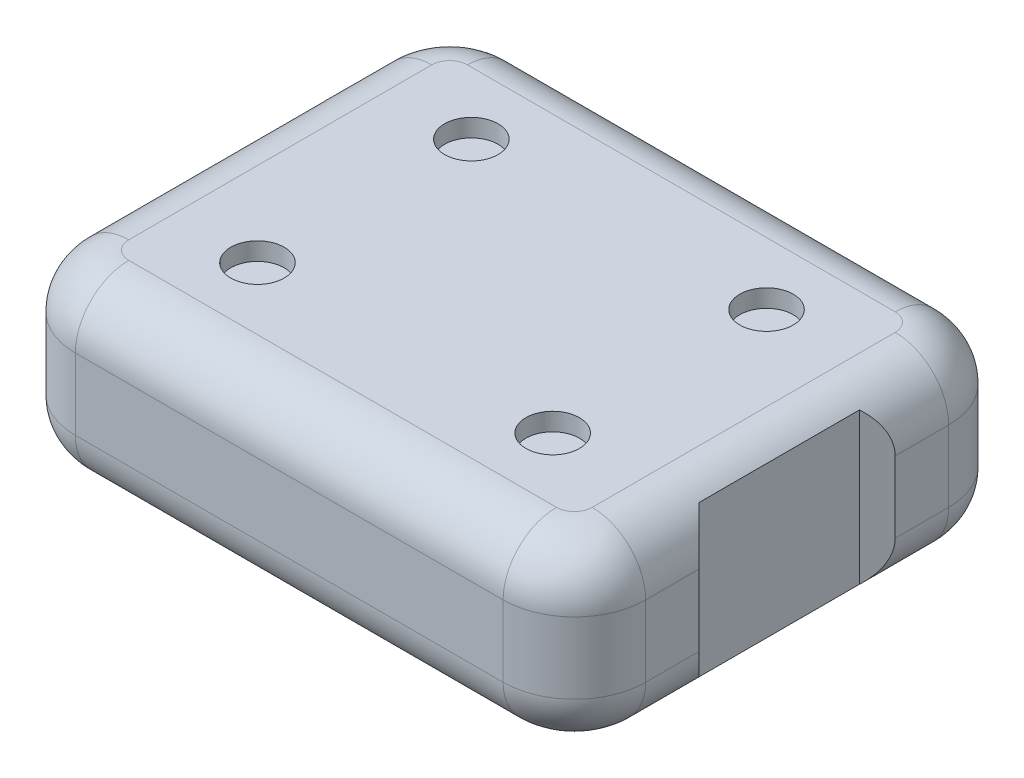
from build123d import *

# Parameters (mm, degrees)
BOSS_EXTRUDE1_DEPTH = 1
FILLET2_R           = 0.3
SKETCH2_R           = 0.15
CUT_EXTRUDE1_DEPTH  = 0.1


with BuildPart() as part:
    # Sketch1 → Boss-Extrude1 (new body)
    with BuildSketch(Plane(origin=(0, 0, 0), x_dir=(1, 0, 0), z_dir=(0, 1, 0))):
        with BuildLine():
            Line((-1.2, -1.25), (1.2, -1.25))
            ThreePointArc((1.2, -1.25), (1.482842712, -1.132842712), (1.6, -0.85))
            Line((1.6, -0.85), (1.6, -0.55))
            Line((1.6, -0.55), (1.5, -0.45))
            Line((1.5, -0.45), (1.5, 0.45))
            Line((1.5, 0.45), (1.6, 0.55))
            Line((1.6, 0.55), (1.6, 0.85))
            ThreePointArc((1.6, 0.85), (1.482842712, 1.132842712), (1.2, 1.25))
            Line((1.2, 1.25), (-1.2, 1.25))
            ThreePointArc((-1.2, 1.25), (-1.482842712, 1.132842712), (-1.6, 0.85))
            Line((-1.6, 0.85), (-1.6, 0.55))
            Line((-1.6, 0.55), (-1.5, 0.45))
            Line((-1.5, 0.45), (-1.5, -0.45))
            Line((-1.5, -0.45), (-1.6, -0.55))
            Line((-1.6, -0.55), (-1.6, -0.85))
            ThreePointArc((-1.6, -0.85), (-1.482842712, -1.132842712), (-1.2, -1.25))
        make_face()
    extrude(amount=BOSS_EXTRUDE1_DEPTH)

    # Fillet2
    # the kernel refuses this fillet: 0.3 mm, written as the material it takes off along each edge
    with BuildSketch(Plane(origin=(-1.2, 1, 0.85), x_dir=(-1, 0, 0), z_dir=(0, 0, -1))) as fillet2_piece_1:
        with BuildLine():
            CenterArc((0.4 - FILLET2_R, -FILLET2_R), FILLET2_R, 0, 90)
            Line((0.4 - FILLET2_R, 0), (0.4, 0))
            Line((0.4, 0), (0.4, -FILLET2_R))
        make_face()
    revolve(axis=Axis((-1.2, 1, 0.85), (0, 1, 0)), revolution_arc=90, mode=Mode.SUBTRACT)
    with BuildSketch(Plane(origin=(-1.2, 1, 1.25), x_dir=(0, -1, 0), z_dir=(1, 0, 0)), Plane(origin=(1.2, 1, -1.25), x_dir=(0, -1, 0), z_dir=(-1, 0, 0))) as fillet2_piece_2:
        with BuildLine():
            CenterArc((FILLET2_R, FILLET2_R), FILLET2_R, 180, 90)
            Line((0, FILLET2_R), (0, 0))
            Line((0, 0), (FILLET2_R, 0))
        make_face()
    extrude(amount=2.4, mode=Mode.SUBTRACT)
    with BuildSketch(Plane(origin=(-1.6, 1, -0.85), x_dir=(0, -1, 0), z_dir=(0, 0, 1)), Plane(origin=(1.6, 1, 0.2), x_dir=(0, -1, 0), z_dir=(0, 0, -1)), Plane(origin=(1.6, 1, 0.85), x_dir=(0, -1, 0), z_dir=(0, 0, -1)), Plane(origin=(-1.6, 1, -0.2), x_dir=(0, -1, 0), z_dir=(0, 0, 1))) as fillet2_piece_3:
        with BuildLine():
            CenterArc((FILLET2_R, FILLET2_R), FILLET2_R, 180, 90)
            Line((0, FILLET2_R), (0, 0))
            Line((0, 0), (FILLET2_R, 0))
        make_face()
    extrude(amount=1.05, mode=Mode.SUBTRACT)
    with BuildSketch(Plane(origin=(-1.2, 1, -0.85), x_dir=(0, 0, -1), z_dir=(1, 0, 0))) as fillet2_piece_4:
        with BuildLine():
            CenterArc((0.4 - FILLET2_R, -FILLET2_R), FILLET2_R, 0, 90)
            Line((0.4 - FILLET2_R, 0), (0.4, 0))
            Line((0.4, 0), (0.4, -FILLET2_R))
        make_face()
    revolve(axis=Axis((-1.2, 1, -0.85), (0, 1, 0)), revolution_arc=90, mode=Mode.SUBTRACT)
    with BuildSketch(Plane(origin=(1.2, 1, -0.85), x_dir=(1, 0, 0), z_dir=(0, 0, 1))) as fillet2_piece_5:
        with BuildLine():
            CenterArc((0.4 - FILLET2_R, -FILLET2_R), FILLET2_R, 0, 90)
            Line((0.4 - FILLET2_R, 0), (0.4, 0))
            Line((0.4, 0), (0.4, -FILLET2_R))
        make_face()
    revolve(axis=Axis((1.2, 1, -0.85), (0, 1, 0)), revolution_arc=90, mode=Mode.SUBTRACT)
    with BuildSketch(Plane(origin=(1.2, 1, 0.85), x_dir=(0, 0, 1), z_dir=(-1, 0, 0))) as fillet2_piece_6:
        with BuildLine():
            CenterArc((0.4 - FILLET2_R, -FILLET2_R), FILLET2_R, 0, 90)
            Line((0.4 - FILLET2_R, 0), (0.4, 0))
            Line((0.4, 0), (0.4, -FILLET2_R))
        make_face()
    revolve(axis=Axis((1.2, 1, 0.85), (0, 1, 0)), revolution_arc=90, mode=Mode.SUBTRACT)
    with BuildSketch(Plane(origin=(1.2, 0, -0.85), x_dir=(1, 0, 0), z_dir=(0, 0, 1))) as fillet2_piece_7:
        with BuildLine():
            CenterArc((0.4 - FILLET2_R, FILLET2_R), FILLET2_R, 270, 90)
            Line((0.4 - FILLET2_R, 0), (0.4, 0))
            Line((0.4, 0), (0.4, FILLET2_R))
        make_face()
    revolve(axis=Axis((1.2, 0, -0.85), (0, 1, 0)), revolution_arc=90, mode=Mode.SUBTRACT)
    with BuildSketch(Plane(origin=(-1.2, 0, -0.85), x_dir=(0, 0, -1), z_dir=(1, 0, 0))) as fillet2_piece_8:
        with BuildLine():
            CenterArc((0.4 - FILLET2_R, FILLET2_R), FILLET2_R, 270, 90)
            Line((0.4 - FILLET2_R, 0), (0.4, 0))
            Line((0.4, 0), (0.4, FILLET2_R))
        make_face()
    revolve(axis=Axis((-1.2, 0, -0.85), (0, 1, 0)), revolution_arc=90, mode=Mode.SUBTRACT)
    with BuildSketch(Plane(origin=(-1.6, 0, -0.2), x_dir=(0, 1, 0), z_dir=(0, 0, 1)), Plane(origin=(1.6, 0, 0.85), x_dir=(0, 1, 0), z_dir=(0, 0, -1)), Plane(origin=(-1.6, 0, -0.85), x_dir=(0, 1, 0), z_dir=(0, 0, 1)), Plane(origin=(1.6, 0, 0.2), x_dir=(0, 1, 0), z_dir=(0, 0, -1))) as fillet2_piece_9:
        with BuildLine():
            CenterArc((FILLET2_R, -FILLET2_R), FILLET2_R, 90, 90)
            Line((0, -FILLET2_R), (0, 0))
            Line((0, 0), (FILLET2_R, 0))
        make_face()
    extrude(amount=1.05, mode=Mode.SUBTRACT)
    with BuildSketch(Plane(origin=(-1.2, 0, 0.85), x_dir=(-1, 0, 0), z_dir=(0, 0, -1))) as fillet2_piece_10:
        with BuildLine():
            CenterArc((0.4 - FILLET2_R, FILLET2_R), FILLET2_R, 270, 90)
            Line((0.4 - FILLET2_R, 0), (0.4, 0))
            Line((0.4, 0), (0.4, FILLET2_R))
        make_face()
    revolve(axis=Axis((-1.2, 0, 0.85), (0, 1, 0)), revolution_arc=90, mode=Mode.SUBTRACT)
    with BuildSketch(Plane(origin=(1.2, 0, 0.85), x_dir=(0, 0, 1), z_dir=(-1, 0, 0))) as fillet2_piece_11:
        with BuildLine():
            CenterArc((0.4 - FILLET2_R, FILLET2_R), FILLET2_R, 270, 90)
            Line((0.4 - FILLET2_R, 0), (0.4, 0))
            Line((0.4, 0), (0.4, FILLET2_R))
        make_face()
    revolve(axis=Axis((1.2, 0, 0.85), (0, 1, 0)), revolution_arc=90, mode=Mode.SUBTRACT)
    with BuildSketch(Plane(origin=(1.2, 0, -1.25), x_dir=(0, 1, 0), z_dir=(-1, 0, 0)), Plane(origin=(-1.2, 0, 1.25), x_dir=(0, 1, 0), z_dir=(1, 0, 0))) as fillet2_piece_12:
        with BuildLine():
            CenterArc((FILLET2_R, -FILLET2_R), FILLET2_R, 90, 90)
            Line((0, -FILLET2_R), (0, 0))
            Line((0, 0), (FILLET2_R, 0))
        make_face()
    extrude(amount=2.4, mode=Mode.SUBTRACT)

    # Sketch2 → Cut-Extrude1 (cut)
    with BuildSketch(Plane(origin=(0, 1, 0), x_dir=(1, 0, 0), z_dir=(0, 1, 0))):
        with Locations(Location((0.82808468, 0.6, 0), (0, 0, 270))):
            Circle(SKETCH2_R)
        with Locations(Location((-0.82808468, 0.6, 0), (0, 0, 270))):
            Circle(SKETCH2_R)
        with Locations(Location((-0.82808468, -0.6, 0), (0, 0, 270))):
            Circle(SKETCH2_R)
        with Locations(Location((0.82808468, -0.6, 0), (0, 0, 270))):
            Circle(SKETCH2_R)
    extrude(amount=-CUT_EXTRUDE1_DEPTH, mode=Mode.SUBTRACT)


solid = part.part
